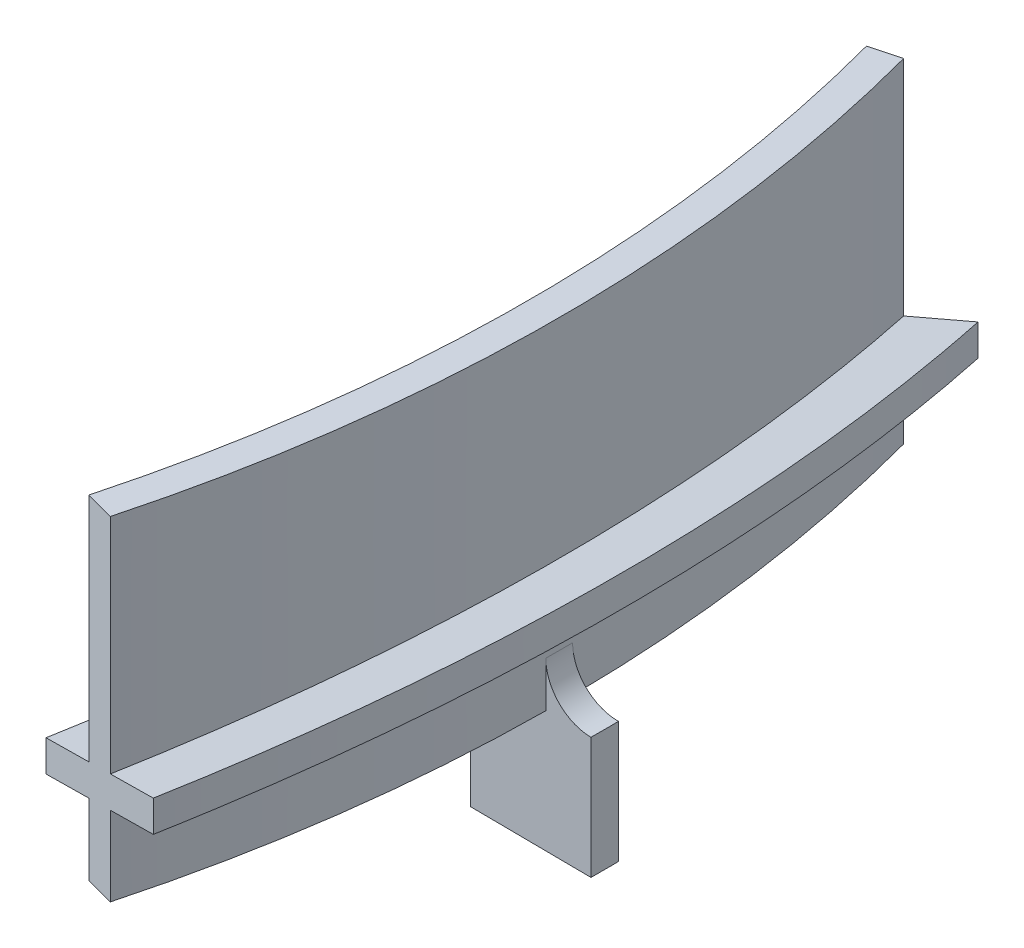
from build123d import *

# Parameters (mm, degrees)
SKETCH1_W           = 2
SKETCH1_H           = 22
REVOLVE1_ANGLE      = 30
BOSS_EXTRUDE2_DEPTH = 57
CUT_EXTRUDE1_START  = -6.211657082
CUT_EXTRUDE1_DEPTH  = 12.423314164
SKETCH16_W          = 8
SKETCH16_H          = 8
REVOLVE2_ANGLE      = 1
FILLET2_R           = 3


# Read off the part's stored shape, not the designer's step: Cut-Extrude1
with BuildPart() as part:
    # Sketch1 → Revolve1 (revolve, symmetric)
    with BuildSketch(Plane.XY) as revolve1_sk:
        with Locations((100, 5)):
            Rectangle(SKETCH1_W, SKETCH1_H)
    revolve(axis=Axis((0, 12.85, 0), (0, -1, 0)), revolution_arc=REVOLVE1_ANGLE / 2)
    revolve(revolve1_sk.sketch, axis=Axis((0, 12.85, 0), (0, 1, 0)), revolution_arc=REVOLVE1_ANGLE / 2)

    # Sketch13 → Boss-Extrude2 (add, along a direction that is not the sketch's normal)
    with BuildSketch(Plane(origin=(0, 0, 0), x_dir=(0.9659258262890682, 0, 0.25881904510252124), z_dir=(-0.25881904510252124, 0, 0.9659258262890682))):
        Polygon((80.681483474, -4.141104722), (119.318516526, 6.211657082), (119.318516526, 4.141104722), (80.681483474, -6.211657082), align=None)
    extrude(amount=-BOSS_EXTRUDE2_DEPTH, dir=(0, 0, 1))

    # Cut-Extrude1 outline → Cut-Extrude1 (cut)
    with BuildSketch(Plane(origin=(0, 0, 0), x_dir=(1, 0, 0), z_dir=(0, 1, 0)).offset(CUT_EXTRUDE1_START)):
        with BuildLine():
            Line((91.762953497, 24.587809285), (101.42221176, 27.175999736))
            ThreePointArc((101.42221176, 27.175999736), (105, 0), (101.42221176, -27.175999736))
            Line((101.42221176, -27.175999736), (115.252836667, -30.88190451))
            Line((115.252836667, -30.88190451), (115.252836667, 26.11809549))
            Line((115.252836667, 26.11809549), (77.932328591, 36.11809549))
            Line((77.932328591, 36.11809549), (77.932328591, -20.88190451))
            Line((77.932328591, -20.88190451), (91.762953497, -24.587809285))
            ThreePointArc((91.762953497, -24.587809285), (95, 0), (91.762953497, 24.587809285))
        make_face()
    extrude(amount=CUT_EXTRUDE1_DEPTH, mode=Mode.SUBTRACT)

    # Sketch16 → Revolve2 (revolve, symmetric)
    with BuildSketch(Plane.XY) as revolve2_sk:
        with Locations((100, -10)):
            Rectangle(SKETCH16_W, SKETCH16_H)
    revolve(axis=Axis((0, 12.85, 0), (0, -1, 0)), revolution_arc=REVOLVE2_ANGLE / 2)
    revolve(revolve2_sk.sketch, axis=Axis((0, 12.85, 0), (0, 1, 0)), revolution_arc=REVOLVE2_ANGLE / 2)

    # Fillet2
    fillet2_edges = [part.edges().sort_by_distance(p)[0] for p in [
        (99, -6, 0),
        (101, -6, 0),
    ]]
    fillet(fillet2_edges, radius=FILLET2_R - 0.0001)  # a hair under: the kernel refuses the full size


solid = part.part
